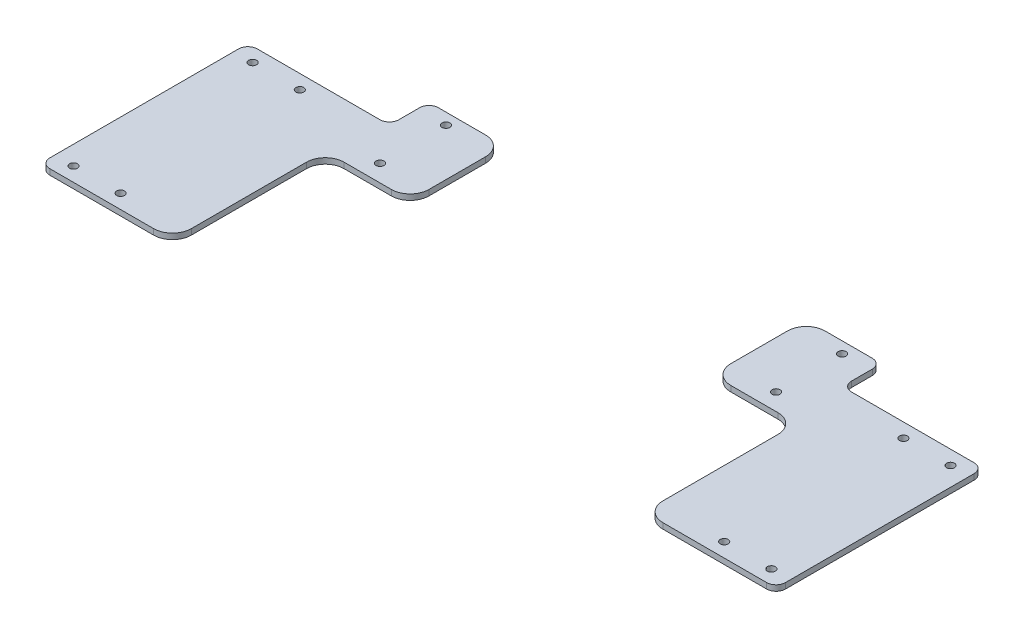
from build123d import *

# Parameters (mm, degrees)
SKETCH_1_W          = 240
SKETCH_1_H          = 166
EXTRUDE_1252_DEPTH  = 3
SKETCH_4_R          = 2.1
SKETCH_4_R_2        = 1.55
CUT_EXTRUDE_3_DEPTH = 251.068459046
SKETCH_5_R          = 1.55
SKETCH_5_R_2        = 10
SKETCH_5_W          = 79
SKETCH_5_H          = 45
CUT_EXTRUDE_4_DEPTH = 251.068459046
SKETCH_6_W          = 75
SKETCH_6_H          = 110
SKETCH_6_R          = 2.1
EXTRUDE_1_DEPTH     = 3
FILLET_1_R          = 5
CUT_EXTRUDE_5_DEPTH = 10
FILLET_2_R          = 10
FILLET_3_R          = 10


with BuildPart() as part:
    # 草图1 → Extrude 1252 (new body)
    with BuildSketch(Plane(origin=(0, 0, 0), x_dir=(1, 0, 0), z_dir=(0, 1, 0))):
        with Locations((31.575924772, -115.871750732)):
            Rectangle(SKETCH_1_W, SKETCH_1_H)
    extrude(amount=EXTRUDE_1252_DEPTH)

    # 草图4 → 切除-拉伸3 (cut, through all)
    with BuildSketch(Plane(origin=(0, 3, 0), x_dir=(1, 0, 0), z_dir=(0, 1, 0))):
        with Locations((-73.424075228, -73.871750732)):
            Circle(SKETCH_4_R)
        with Locations((136.575924772, -178.871750732)):
            Circle(SKETCH_4_R)
        with Locations((-73.424075228, -108.871750732)):
            Circle(SKETCH_4_R)
        with Locations((-73.424075228, -143.871750732)):
            Circle(SKETCH_4_R)
        with Locations((-73.424075228, -178.871750732)):
            Circle(SKETCH_4_R)
        with Locations((136.575924772, -143.871750732)):
            Circle(SKETCH_4_R)
        with Locations((136.575924772, -108.871750732)):
            Circle(SKETCH_4_R)
        with Locations((136.575924772, -73.871750732)):
            Circle(SKETCH_4_R)
        with Locations((-73.424075228, -38.871750732)):
            Circle(SKETCH_4_R)
        with Locations((136.575924772, -38.871750732)):
            Circle(SKETCH_4_R)
        with Locations((77.075924772, -188.871750732)):
            Circle(SKETCH_4_R_2)
        with Locations((-13.924075228, -188.871750732)):
            Circle(SKETCH_4_R_2)
        with Locations((77.075924772, -153.871750732)):
            Circle(SKETCH_4_R_2)
        with Locations((-13.924075228, -153.871750732)):
            Circle(SKETCH_4_R_2)
    extrude(amount=-CUT_EXTRUDE_3_DEPTH, mode=Mode.SUBTRACT)

    # 草图5 → 切除-拉伸4 (cut, through all)
    with BuildSketch(Plane(origin=(0, 3, 0), x_dir=(1, 0, 0), z_dir=(0, 1, 0))):
        with Locations((-5.424075228, -51.871750732)):
            Circle(SKETCH_5_R)
        with Locations((68.575924772, -51.871750732)):
            Circle(SKETCH_5_R)
        with Locations((68.575924772, -108.871750732)):
            Circle(SKETCH_5_R)
        with Locations((-5.424075228, -108.871750732)):
            Circle(SKETCH_5_R)
        with Locations((-45.424075228, -143.871750732)):
            Circle(SKETCH_5_R_2)
        with Locations((108.575924772, -143.871750732)):
            Circle(SKETCH_5_R_2)
        with Locations((31.575924772, -80.371750732)):
            Rectangle(SKETCH_5_W, SKETCH_5_H)
        with BuildLine():
            Line((86.075924772, -100.371750732), (86.075924772, -60.371750732))
            ThreePointArc((86.075924772, -60.371750732), (91.075924772, -55.371750732), (96.075924772, -60.371750732))
            Line((96.075924772, -60.371750732), (96.075924772, -100.371750732))
            ThreePointArc((96.075924772, -100.371750732), (91.075924772, -105.371750732), (86.075924772, -100.371750732))
        make_face()
        with BuildLine():
            Line((1.575924772, -117.871750732), (61.575924772, -117.871750732))
            ThreePointArc((61.575924772, -117.871750732), (68.575924772, -124.871750732), (61.575924772, -131.871750732))
            Line((61.575924772, -131.871750732), (41.575924772, -131.871750732))
            ThreePointArc((41.575924772, -131.871750732), (31.575924772, -141.871750732), (21.575924772, -131.871750732))
            Line((21.575924772, -131.871750732), (1.575924772, -131.871750732))
            ThreePointArc((1.575924772, -131.871750732), (-5.424075228, -124.871750732), (1.575924772, -117.871750732))
        make_face()
    extrude(amount=-CUT_EXTRUDE_4_DEPTH, mode=Mode.SUBTRACT)

    # 草图6 → 凸台-拉伸1 (add)
    # profile 1 of 2: a face of its own
    with BuildSketch(Plane(origin=(0, 0, 0), x_dir=(1, 0, 0), z_dir=(0, 1, 0))):
        with Locations((-125.924075228, -108.871750732)):
            Rectangle(SKETCH_6_W, SKETCH_6_H)
        with Locations((-153.424075228, -61.371750732)):
            Circle(SKETCH_6_R, mode=Mode.SUBTRACT)
        with Locations((-153.424075228, -156.371750732)):
            Circle(SKETCH_6_R, mode=Mode.SUBTRACT)
        with Locations((-128.424075228, -61.371750732)):
            Circle(SKETCH_6_R, mode=Mode.SUBTRACT)
        with Locations((-128.424075228, -156.371750732)):
            Circle(SKETCH_6_R, mode=Mode.SUBTRACT)
    # profile 2 of 2: a face of its own
    with BuildSketch(Plane(origin=(0, 0, 0), x_dir=(1, 0, 0), z_dir=(0, 1, 0))):
        with Locations((189.075924772, -108.871750732)):
            Rectangle(SKETCH_6_W, SKETCH_6_H)
        with Locations((216.575924772, -156.371750732)):
            Circle(SKETCH_6_R, mode=Mode.SUBTRACT)
        with Locations((216.575924772, -61.371750732)):
            Circle(SKETCH_6_R, mode=Mode.SUBTRACT)
        with Locations((191.575924772, -156.371750732)):
            Circle(SKETCH_6_R, mode=Mode.SUBTRACT)
        with Locations((191.575924772, -61.371750732)):
            Circle(SKETCH_6_R, mode=Mode.SUBTRACT)
    extrude(amount=EXTRUDE_1_DEPTH)

    # 圆角1
    fillet_1_edges = [part.edges().sort_by_distance(p)[0] for p in [
        (71.075924772, 1.5, 102.871750732),
        (-7.924075228, 1.5, 102.871750732),
        (-7.924075228, 1.5, 57.871750732),
        (71.075924772, 1.5, 57.871750732),
        (151.575924772, 1.5, 32.871750732),
        (-88.424075228, 1.5, 32.871750732),
        (151.575924772, 1.5, 53.871750732),
        (151.575924772, 1.5, 163.871750732),
        (-88.424075228, 1.5, 163.871750732),
        (-88.424075228, 1.5, 53.871750732),
        (226.575924772, 1.5, 53.871750732),
        (226.575924772, 1.5, 163.871750732),
        (151.575924772, 1.5, 198.871750732),
        (-88.424075228, 1.5, 198.871750732),
        (-163.424075228, 1.5, 53.871750732),
        (-163.424075228, 1.5, 163.871750732),
        (41.575924772, 1.5, 131.871750732),
        (21.575924772, 1.5, 131.871750732),
    ]]
    fillet(fillet_1_edges, radius=FILLET_1_R)

    # 草图7 → 切除-拉伸5 (cut)
    with BuildSketch(Plane(origin=(0, 3, 0), x_dir=(1, 0, 0), z_dir=(0, 1, 0))):
        Polygon((111.575924772, -32.871750732), (-48.424075228, -32.871750732), (-48.424075228, -82.871750732), (-93.424075228, -82.871750732), (-93.424075228, -208.191480029), (156.575924772, -208.191480029), (156.575924772, -82.871750732), (111.575924772, -82.871750732), align=None)
    extrude(amount=-CUT_EXTRUDE_5_DEPTH, mode=Mode.SUBTRACT)


with BuildPart() as cut_extrude_5_piece_1:
    # of the separate pieces the step leaves, piece 1, a body of its own (cut_extrude_5_pieces)
    add(part.part.solids().sort_by_distance((-88.424075228, 0, 37.871750732))[0])

    # 圆角2
    fillet_2_edges = [cut_extrude_5_piece_1.edges().sort_by_distance(p)[0] for p in [
        (-48.424075228, 1.5, 32.871750732),
        (-48.424075228, 1.5, 82.871750732),
        (-93.424075228, 1.5, 163.871750732),
        (-93.424075228, 1.5, 82.871750732),
    ]]
    fillet(fillet_2_edges, radius=FILLET_2_R)


with BuildPart() as cut_extrude_5_piece_2:
    # of the separate pieces the step leaves, piece 2, a body of its own (cut_extrude_5_pieces)
    add(part.part.solids().sort_by_distance((146.575924772, 0, 32.871750732))[0])

    # 圆角3
    fillet_3_edges = [cut_extrude_5_piece_2.edges().sort_by_distance(p)[0] for p in [
        (156.575924772, 1.5, 163.871750732),
        (156.575924772, 1.5, 82.871750732),
        (111.575924772, 1.5, 82.871750732),
        (111.575924772, 1.5, 32.871750732),
    ]]
    fillet(fillet_3_edges, radius=FILLET_3_R)


solid = Compound([cut_extrude_5_piece_1.part, cut_extrude_5_piece_2.part])
